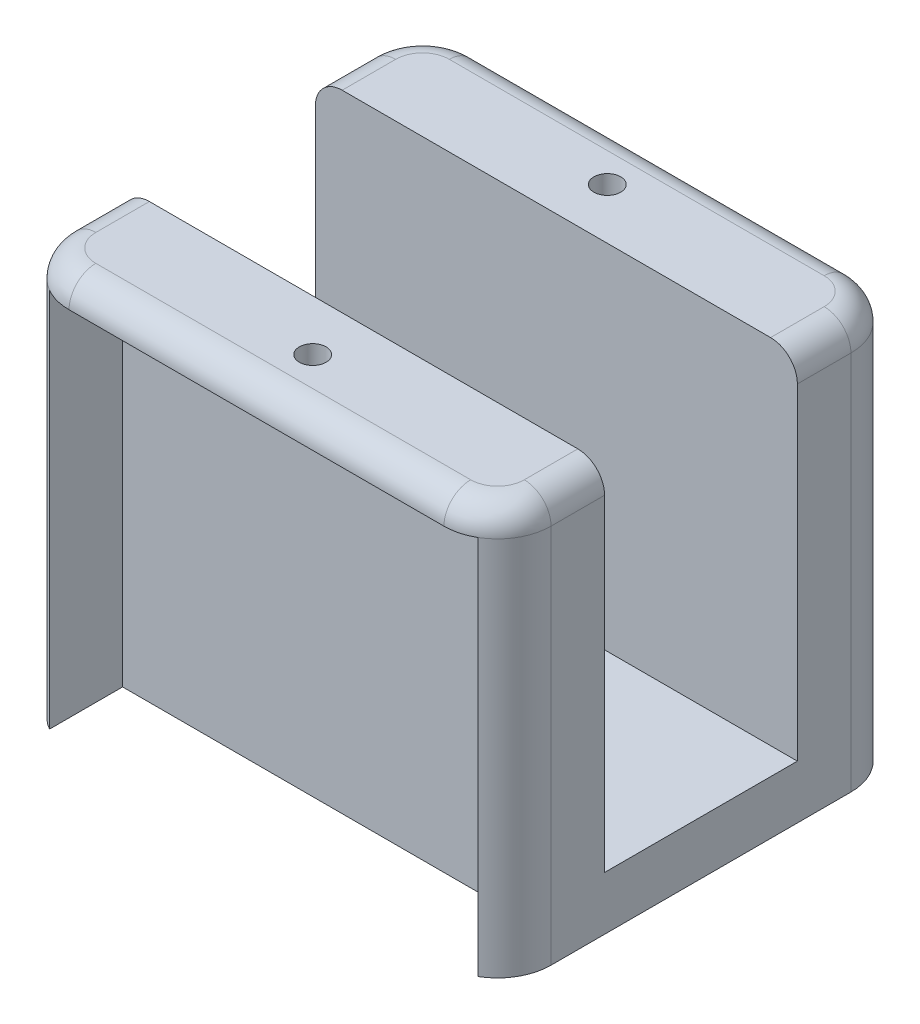
from build123d import *

# Parameters (mm, degrees)
SKETCH1_W           = 90
SKETCH1_H           = 66
BOSS_EXTRUDE1_DEPTH = 76
SKETCH2_W           = 90
SKETCH2_H           = 36
CUT_EXTRUDE1_DEPTH  = 66
SKETCH3_W           = 90
SKETCH3_H           = 76
BOSS_EXTRUDE4_DEPTH = 5
SKETCH11_W          = 90
SKETCH11_H          = 76
BOSS_EXTRUDE5_DEPTH = 5
SKETCH12_W          = 80
SKETCH12_H          = 71
CUT_EXTRUDE9_DEPTH  = 15
SKETCH13_W          = 80
SKETCH13_H          = 71
CUT_EXTRUDE10_DEPTH = 15
SKETCH14_R          = 2.5
CUT_EXTRUDE11_DEPTH = 5
SKETCH15_R          = 2.5
CUT_EXTRUDE12_DEPTH = 5
FILLET1_R           = 10
FILLET2_R           = 5


with BuildPart() as part:
    # Sketch1 → Boss-Extrude1 (new body)
    with BuildSketch(Plane(origin=(0, 0, 0), x_dir=(1, 0, 0), z_dir=(0, 1, 0))):
        Rectangle(SKETCH1_W, SKETCH1_H)
    extrude(amount=BOSS_EXTRUDE1_DEPTH)

    # Sketch2 → Cut-Extrude1 (cut)
    with BuildSketch(Plane(origin=(0, 76, 0), x_dir=(1, 0, 0), z_dir=(0, 1, 0))):
        Rectangle(SKETCH2_W, SKETCH2_H)
    extrude(amount=-CUT_EXTRUDE1_DEPTH, mode=Mode.SUBTRACT)

    # Sketch3 → Boss-Extrude4 (add)
    with BuildSketch(Plane(origin=(0, 0, -33), x_dir=(-1, 0, 0), z_dir=(0, 0, -1))):
        with Locations((0, 38)):
            Rectangle(SKETCH3_W, SKETCH3_H)
    extrude(amount=BOSS_EXTRUDE4_DEPTH)

    # Sketch11 → Boss-Extrude5 (add)
    with BuildSketch(Plane.XY.offset(33)):
        with Locations((0, 38)):
            Rectangle(SKETCH11_W, SKETCH11_H)
    extrude(amount=BOSS_EXTRUDE5_DEPTH)

    # Sketch12 → Cut-Extrude9 (cut)
    with BuildSketch(Plane.XY.offset(38)):
        with Locations((0, 35.5)):
            Rectangle(SKETCH12_W, SKETCH12_H)
    extrude(amount=-CUT_EXTRUDE9_DEPTH, mode=Mode.SUBTRACT)

    # Sketch13 → Cut-Extrude10 (cut)
    with BuildSketch(Plane(origin=(0, 0, -38), x_dir=(-1, 0, 0), z_dir=(0, 0, -1))):
        with Locations((0, 35.5)):
            Rectangle(SKETCH13_W, SKETCH13_H)
    extrude(amount=-CUT_EXTRUDE10_DEPTH, mode=Mode.SUBTRACT)

    # Sketch14 → Cut-Extrude11 (cut)
    with BuildSketch(Plane(origin=(0, 76, 0), x_dir=(1, 0, 0), z_dir=(0, 1, 0))):
        with Locations(Location((0, 27.5, 0), (0, 0, 270))):
            Circle(SKETCH14_R)
    extrude(amount=-CUT_EXTRUDE11_DEPTH, mode=Mode.SUBTRACT)

    # Sketch15 → Cut-Extrude12 (cut)
    with BuildSketch(Plane(origin=(0, 76, 0), x_dir=(1, 0, 0), z_dir=(0, 1, 0))):
        with Locations(Location((0, -27.5, 0), (0, 0, 270))):
            Circle(SKETCH15_R)
    extrude(amount=-CUT_EXTRUDE12_DEPTH, mode=Mode.SUBTRACT)

    # Fillet1
    fillet1_edges = [part.edges().sort_by_distance(p)[0] for p in [
        (-45, 38, -38),
        (45, 38, -38),
        (-45, 38, 38),
        (45, 38, 38),
    ]]
    fillet(fillet1_edges, radius=FILLET1_R)

    # Fillet2
    fillet2_edges = [part.edges().sort_by_distance(p)[0] for p in [
        (45, 76, -23),
        (42.071067812, 76, -35.071067812),
        (-42.071067812, 76, -35.071067812),
        (45, 76, 23),
        (42.071067812, 76, 35.071067812),
        (0, 76, 38),
        (-42.071067812, 76, 35.071067812),
        (0, 76, -38),
        (-45, 76, -23),
        (-45, 76, 23),
    ]]
    fillet(fillet2_edges, radius=FILLET2_R - 0.0001)  # a hair under: the kernel refuses the full size


solid = part.part
